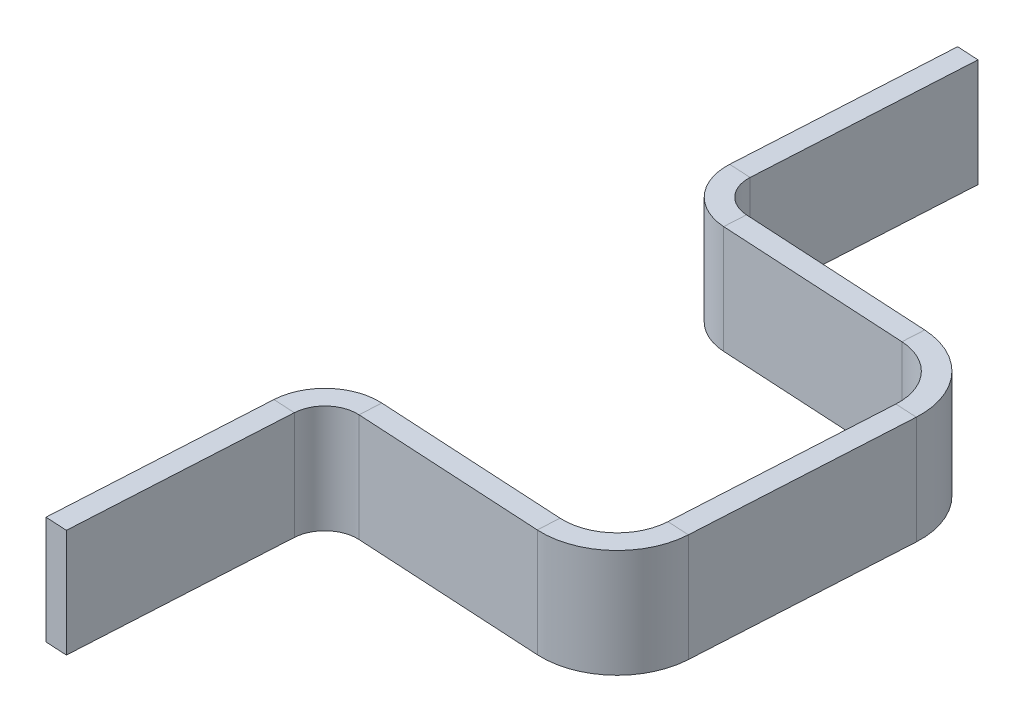
from build123d import *

# Parameters (mm, degrees)
BASE_FLANGE2_DEPTH = 20


# Sheet-metal steps are written as plain solids
with BuildPart() as part:
    # Sketch8 → Base-Flange2 (new body)
    with BuildSketch(Plane(origin=(0, 0, 0), x_dir=(1, 0, 0), z_dir=(0, 1, 0))):
        with BuildLine():
            Line((0, 0), (2.237517434, 39.937369915))
            ThreePointArc((2.237517434, 39.937369915), (5.557404578, 46.833527767), (12.781239271, 49.362333035))
            Line((12.781239271, 49.362333035), (47.726437947, 47.40450528))
            ThreePointArc((47.726437947, 47.40450528), (54.95027264, 49.933310549), (58.270159784, 56.829468401))
            Line((58.270159784, 56.829468401), (60.507677219, 96.766838316))
            ThreePointArc((60.507677219, 96.766838316), (57.97887195, 103.990673009), (51.082714098, 107.310560153))
            Line((51.082714098, 107.310560153), (16.137515423, 109.268387908))
            ThreePointArc((16.137515423, 109.268387908), (9.241357571, 112.588275052), (6.712552303, 119.812109745))
            Line((6.712552303, 119.812109745), (8.950069737, 159.74947966))
            Line((8.950069737, 159.74947966), (12.943806728, 159.525727917))
            Line((12.943806728, 159.525727917), (10.706289294, 119.588358002))
            ThreePointArc((10.706289294, 119.588358002), (12.223572455, 115.254057186), (16.361267166, 113.262124899))
            Line((16.361267166, 113.262124899), (51.306465842, 111.304297144))
            ThreePointArc((51.306465842, 111.304297144), (60.961086834, 106.656455143), (64.50141421, 96.543086572))
            Line((64.50141421, 96.543086572), (62.263896776, 56.605716657))
            ThreePointArc((62.263896776, 56.605716657), (57.616054774, 46.951095665), (47.502686204, 43.410768289))
            Line((47.502686204, 43.410768289), (12.557487528, 45.368596044))
            ThreePointArc((12.557487528, 45.368596044), (8.223186712, 43.851312883), (6.231254426, 39.713618172))
            Line((6.231254426, 39.713618172), (3.993736992, -0.223751743))
            Line((3.993736992, -0.223751743), (0, 0))
        make_face()
    extrude(amount=BASE_FLANGE2_DEPTH)


solid = part.part
